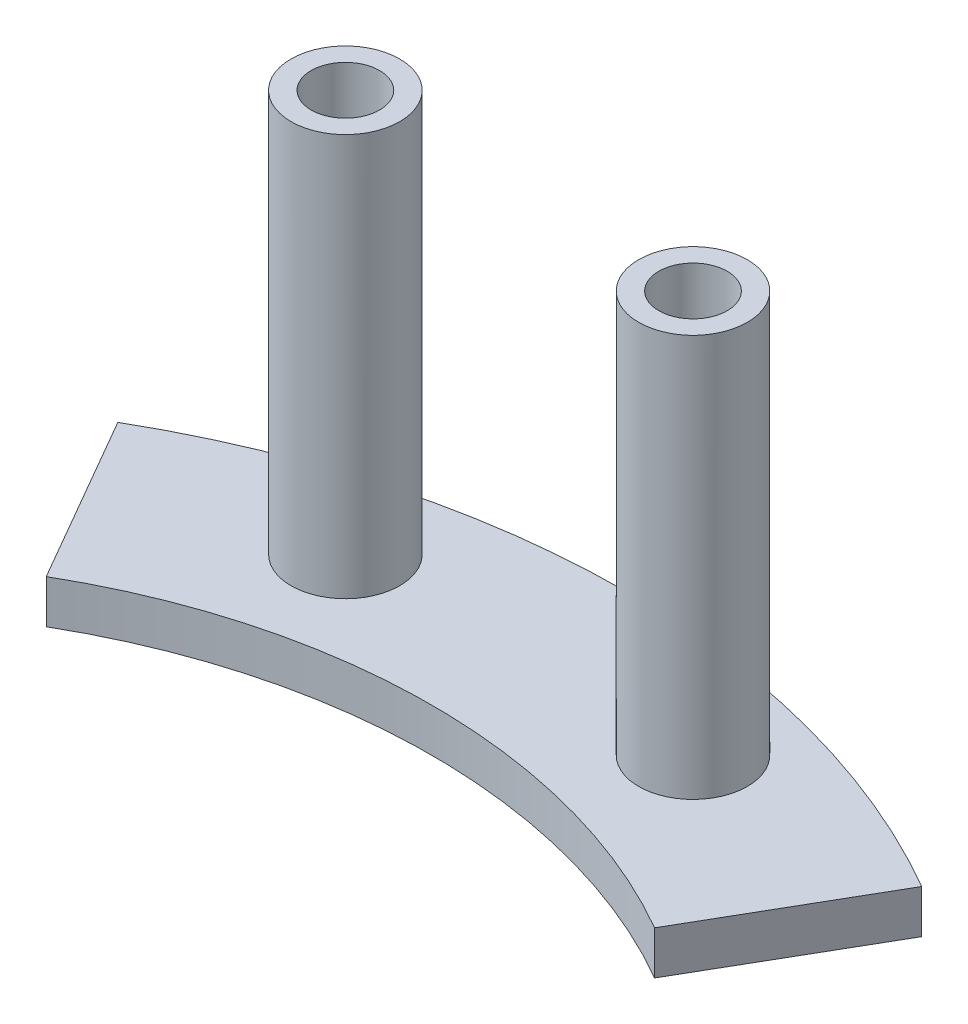
from build123d import *

# Parameters (mm, degrees)
BOSS_EXTRUDE1_DEPTH = 2
SKETCH2_R           = 2.5
BOSS_EXTRUDE2_DEPTH = 18.5
SKETCH5_R           = 1.575
CUT_EXTRUDE1_DEPTH  = 3.5


with BuildPart() as part:
    # Sketch1 → Boss-Extrude1 (new body)
    with BuildSketch(Plane(origin=(0, 0, 0), x_dir=(1, 0, 0), z_dir=(0, 1, 0))):
        with BuildLine():
            Line((-18.5, 32.04293994), (-14, 24.248711306))
            ThreePointArc((-14, 24.248711306), (0, 28), (14, 24.248711306))
            Line((14, 24.248711306), (18.5, 32.04293994))
            ThreePointArc((18.5, 32.04293994), (0, 37), (-18.5, 32.04293994))
        make_face()
    extrude(amount=BOSS_EXTRUDE1_DEPTH)

    # Sketch2 → Boss-Extrude2 (add)
    with BuildSketch(Plane(origin=(0, 2, 0), x_dir=(1, 0, 0), z_dir=(0, 1, 0))):
        with Locations((-8, 32.015621187)):
            Circle(SKETCH2_R)
        with Locations((8, 32.015621187)):
            Circle(SKETCH2_R)
    extrude(amount=BOSS_EXTRUDE2_DEPTH)

    # Sketch5 → Cut-Extrude1 (cut)
    with BuildSketch(Plane(origin=(0, 20.5, 0), x_dir=(1, 0, 0), z_dir=(0, 1, 0))):
        with Locations((-8, 32.015621187)):
            Circle(SKETCH5_R)
        with Locations((8, 32.015621187)):
            Circle(SKETCH5_R)
    extrude(amount=-CUT_EXTRUDE1_DEPTH, mode=Mode.SUBTRACT)


solid = part.part
